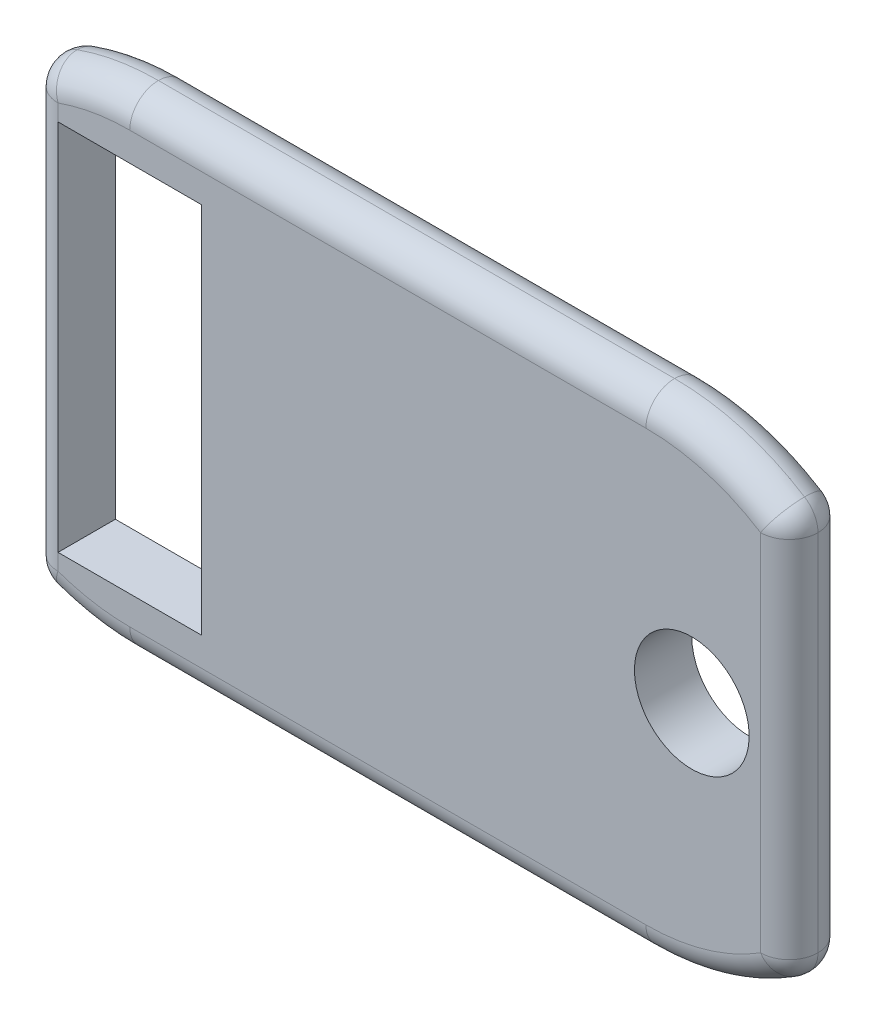
from build123d import *

# Parameters (mm, degrees)
BOSS_EXTRUDE1_DEPTH = 10
SKETCH2_W           = 25
SKETCH2_H           = 65
CUT_EXTRUDE2_DEPTH  = 20
SKETCH3_R           = 10
CUT_EXTRUDE3_DEPTH  = 20
FILLET2_R           = 5


with BuildPart() as part:
    # Sketch1 → Boss-Extrude1 (new body)
    with BuildSketch(Plane.XY):
        with BuildLine():
            Line((-51.324273213, 15.030948404), (38.675726787, 15.030948404))
            ThreePointArc((38.675726787, 15.030948404), (51.820193251, 12.947195155), (63.675726787, 6.900266117))
            Line((63.675726787, 6.900266117), (63.675726787, -61.838369308))
            ThreePointArc((63.675726787, -61.838369308), (51.820193251, -67.885298346), (38.675726787, -69.969051596))
            Line((38.675726787, -69.969051596), (-51.324273213, -69.969051596))
            ThreePointArc((-51.324273213, -69.969051596), (-60.275029546, -69.015819954), (-68.824273213, -66.198885058))
            Line((-68.824273213, -66.198885058), (-68.824273213, 11.260781867))
            ThreePointArc((-68.824273213, 11.260781867), (-60.275029546, 14.077716763), (-51.324273213, 15.030948404))
        make_face()
    extrude(amount=BOSS_EXTRUDE1_DEPTH)

    # Sketch2 → Cut-Extrude2 (cut)
    with BuildSketch(Plane(origin=(0, 0, 0), x_dir=(-1, 0, 0), z_dir=(0, 0, -1))):
        with Locations((51.324273213, -27.469051596)):
            Rectangle(SKETCH2_W, SKETCH2_H)
    extrude(amount=-CUT_EXTRUDE2_DEPTH, mode=Mode.SUBTRACT)

    # Sketch3 → Cut-Extrude3 (cut)
    with BuildSketch(Plane(origin=(0, 0, 0), x_dir=(-1, 0, 0), z_dir=(0, 0, -1))):
        with Locations((-46.675726787, -27.469051596)):
            Circle(SKETCH3_R)
    extrude(amount=-CUT_EXTRUDE3_DEPTH, mode=Mode.SUBTRACT)

    # Fillet2
    fillet2_edges = [part.edges().sort_by_distance(p)[0] for p in [
        (51.820193251, 12.947195155, 10),
        (63.675726787, -27.469051596, 0),
        (51.820193251, -67.885298346, 0),
        (-6.324273213, 15.030948404, 10),
        (38.675726787, -69.969051596, 5),
        (-51.324273213, -69.969051596, 5),
        (-68.824273213, -66.198885058, 5),
        (-68.824273213, 11.260781867, 5),
        (-51.324273213, 15.030948404, 5),
        (38.675726787, 15.030948404, 5),
        (63.675726787, 6.900266117, 5),
        (63.675726787, -61.838369308, 5),
        (-60.275029546, 14.077716763, 10),
        (-68.824273213, -27.469051596, 10),
        (-60.275029546, -69.015819954, 10),
        (-6.324273213, -69.969051596, 10),
        (51.820193251, -67.885298346, 10),
        (63.675726787, -27.469051596, 10),
        (-6.324273213, -69.969051596, 0),
        (-60.275029546, -69.015819954, 0),
        (-68.824273213, -27.469051596, 0),
        (-60.275029546, 14.077716763, 0),
        (-6.324273213, 15.030948404, 0),
        (51.820193251, 12.947195155, 0),
    ]]
    fillet(fillet2_edges, radius=FILLET2_R - 0.0001)  # a hair under: the kernel refuses the full size


solid = part.part
